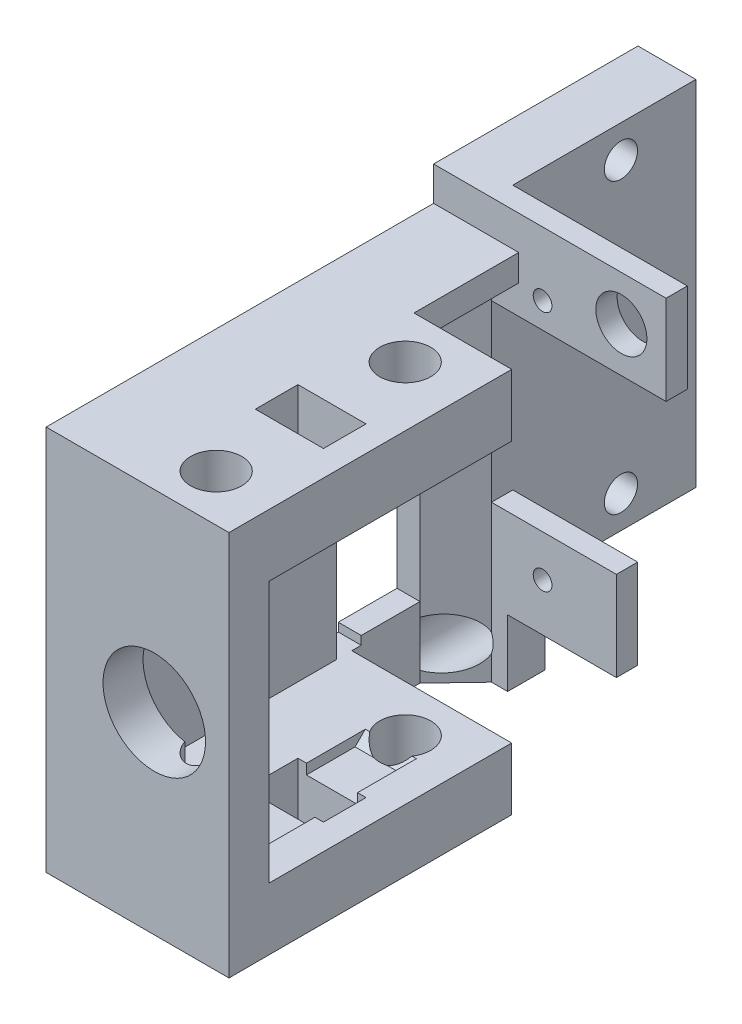
from build123d import *

# Parameters (mm, degrees)
CROQUIS4_W              = 45.5
CROQUIS4_H              = 45.3
SALIENTE_EXTRUIR3_DEPTH = 21.47
CROQUIS5_W              = 41.141731218
CROQUIS5_H              = 30.7
CORTAR_EXTRUIR2_DEPTH   = 18.77
CROQUIS6_W              = 18.6
CROQUIS6_H              = 24.6
CORTAR_EXTRUIR3_DEPTH   = 18.77
CROQUIS7_R              = 3
CORTAR_EXTRUIR4_DEPTH   = 58.77
CROQUIS8_R              = 6.02
CORTAR_EXTRUIR5_DEPTH   = 58.77
CROQUIS9_W              = 6
CROQUIS9_H              = 16.319841708
CORTAR_EXTRUIR7_DEPTH   = 1.2
CHAFL_N1_SIZE           = 1.2
CROQUIS10_W             = 8
CROQUIS10_H             = 5
CORTAR_EXTRUIR8_DEPTH   = 71.2
CROQUIS11_W             = 6
CROQUIS11_H             = 16.418152186
CORTAR_EXTRUIR9_DEPTH   = 1.2
CHAFL_N2_SIZE           = 1.2
CORTAR_EXTRUIR12_DEPTH  = 11.2
CORTAR_EXTRUIR14_DEPTH  = 7
CROQUIS15_W             = 12.3
CROQUIS15_H             = 4.2
CORTAR_EXTRUIR15_DEPTH  = 9.47
CROQUIS16_W             = 7
CROQUIS16_H             = 5
CORTAR_EXTRUIR17_DEPTH  = 0.3
CROQUIS17_W             = 7
CROQUIS17_H             = 0.8
SALIENTE_EXTRUIR4_DEPTH = 3
CROQUIS18_W             = 21.819351721
CROQUIS18_H             = 12.3
CORTAR_EXTRUIR18_DEPTH  = 53
SALIENTE_EXTRUIR5_START = -2.7
CROQUIS19_W             = 24
CROQUIS19_H             = 41.5
SALIENTE_EXTRUIR5_DEPTH = 6.8
CROQUIS21_W             = 2.5
CROQUIS21_H             = 10.5
SALIENTE_EXTRUIR6_DEPTH = 20.5
CROQUIS22_R             = 1.95
CORTAR_EXTRUIR19_DEPTH  = 20.5
CROQUIS23_W             = 9.795322327
CROQUIS23_H             = 20.802243728
CORTAR_EXTRUIR20_DEPTH  = 20.5
CROQUIS24_R             = 1.1
CORTAR_EXTRUIR22_DEPTH  = 2.5
CROQUIS25_W             = 2.17
CROQUIS25_H             = 12.3
CORTAR_EXTRUIR23_DEPTH  = 13
CROQUIS26_R             = 3
CORTAR_EXTRUIR24_DEPTH  = 2.5
SALIENTE_EXTRUIR7_REACH = 70.642
CROQUIS31_W             = 4.4
CROQUIS31_H             = 7.8
SALIENTE_EXTRUIR8_DEPTH = 8.7
CROQUIS32_R             = 3
CORTAR_EXTRUIR25_DEPTH  = 8.7


# Some blends are built 0.0001 mm under size
with BuildPart() as part:
    # Croquis4 → Saliente-Extruir3 (new body)
    with BuildSketch(Plane(origin=(0, 0, 0), x_dir=(0, 0, -1), z_dir=(1, 0, 0))):
        Rectangle(CROQUIS4_W, CROQUIS4_H)
    extrude(amount=SALIENTE_EXTRUIR3_DEPTH)

    # Croquis5 → Cortar-Extruir2 (cut)
    with BuildSketch(Plane(origin=(21.47, 0, 0), x_dir=(0, 0, -1), z_dir=(1, 0, 0))):
        with Locations((2.520865609, 0)):
            Rectangle(CROQUIS5_W, CROQUIS5_H)
    extrude(amount=-CORTAR_EXTRUIR2_DEPTH, mode=Mode.SUBTRACT)

    # Croquis6 → Cortar-Extruir3 (cut)
    with BuildSketch(Plane(origin=(0, 22.65, 0), x_dir=(1, 0, 0), z_dir=(0, 1, 0))):
        with Locations((21.47, 22.75)):
            Rectangle(CROQUIS6_W, CROQUIS6_H)
    extrude(amount=-CORTAR_EXTRUIR3_DEPTH, mode=Mode.SUBTRACT)

    # Croquis7 → Cortar-Extruir4 (cut)
    with BuildSketch(Plane(origin=(0, 22.65, 0), x_dir=(1, 0, 0), z_dir=(0, 1, 0))):
        with Locations(Location((14.47, -17.25, 0), (0, 0, 270))):
            Circle(CROQUIS7_R)
        with Locations(Location((14.47, 4.95, 0), (0, 0, 270))):
            Circle(CROQUIS7_R)
    extrude(amount=-CORTAR_EXTRUIR4_DEPTH, mode=Mode.SUBTRACT)

    # Croquis8 → Cortar-Extruir5 (cut)
    with BuildSketch(Plane.XY.offset(22.75)):
        with Locations((12.7, 0)):
            Circle(CROQUIS8_R)
    extrude(amount=-CORTAR_EXTRUIR5_DEPTH, mode=Mode.SUBTRACT)

    # Croquis9 → Cortar-Extruir7 (cut)
    with BuildSketch(Plane.XZ.offset(-15.35)):
        with Locations((14.47, 6.060847086)):
            Rectangle(CROQUIS9_W, CROQUIS9_H)
    extrude(amount=-CORTAR_EXTRUIR7_DEPTH, mode=Mode.SUBTRACT)

    # Chaflán1
    # the kernel refuses this chamfer: 1.2 mm, written as the material it takes off along each edge
    with BuildSketch(Plane(origin=(12.317907402, 15.35, -2.099073768), x_dir=(0, -0.027495876610584495, -0.9996219169112968), z_dir=(1, 0, 0)), Plane(origin=(11.47, 15.35, -2.099073768), x_dir=(0, -0.027495876610584533, -0.9996219169112968), z_dir=(1, 0, 0))) as chafl_n1_piece_1:
        Polygon((CHAFL_N1_SIZE * 0.999621916911, CHAFL_N1_SIZE * 0.0274958766106), (-CHAFL_N1_SIZE * 0.0274958766106, CHAFL_N1_SIZE * 0.999621916911), (0, 0), align=None)
    extrude(amount=5.152092598, mode=Mode.SUBTRACT)
    with BuildSketch(Plane(origin=(17.47, 15.35, 14.22076794), x_dir=(0, -0.027495876610585984, 0.9996219169112968), z_dir=(-1, 0, 0))) as chafl_n1_piece_2_section:
        Polygon((CHAFL_N1_SIZE * 0.999621916911, CHAFL_N1_SIZE * 0.0274958766106), (-CHAFL_N1_SIZE * 0.0274958766106, CHAFL_N1_SIZE * 0.999621916911), (0, 0), align=None)
    chafl_n1_piece_2 = extrude(amount=6, mode=Mode.PRIVATE)
    chafl_n1_piece_2 = split(chafl_n1_piece_2, bisect_by=Plane(origin=(14.47, 16.55, 14.617252925), z_dir=(0, -1, 0)), keep=Keep.TOP, mode=Mode.PRIVATE)
    add(chafl_n1_piece_2, mode=Mode.SUBTRACT)

    # Croquis10 → Cortar-Extruir8 (cut)
    with BuildSketch(Plane(origin=(0, 22.65, 0), x_dir=(1, 0, 0), z_dir=(0, 1, 0))):
        with Locations((14.47, -6.15)):
            Rectangle(CROQUIS10_W, CROQUIS10_H)
    extrude(amount=-CORTAR_EXTRUIR8_DEPTH, mode=Mode.SUBTRACT)

    # Croquis11 → Cortar-Extruir9 (cut)
    with BuildSketch(Plane(origin=(0, -15.35, 0), x_dir=(1, 0, 0), z_dir=(0, 1, 0))):
        with Locations((14.47, -6.15)):
            Rectangle(CROQUIS11_W, CROQUIS11_H)
    extrude(amount=-CORTAR_EXTRUIR9_DEPTH, mode=Mode.SUBTRACT)

    # Chaflán2
    chafl_n2_edges = [part.edges().sort_by_distance(p)[0] for p in [
        (12.569201122, -15.35, -2.059076093),
        (16.370798878, -15.35, -2.059076093),
        (12.569201122, -15.35, 14.359076093),
        (16.370798878, -15.35, 14.359076093),
    ]]
    chamfer(chafl_n2_edges, length=CHAFL_N2_SIZE - 0.0001)  # a hair under: the kernel refuses the full size

    # Croquis12 → Cortar-Extruir12 (cut)
    with BuildSketch(Plane(origin=(2.7, 0, 0), x_dir=(0, 0, -1), z_dir=(1, 0, 0))):
        Polygon((8.65, 15.35), (8.65, -15.35), (11.55469898, -15.35), (11.55469898, -14.35), (18.45, -14.35), (18.45, 15.35), align=None)
    extrude(amount=-CORTAR_EXTRUIR12_DEPTH, mode=Mode.SUBTRACT)

    # Croquis14 → Cortar-Extruir14 (cut)
    with BuildSketch(Plane(origin=(2.7, 0, 0), x_dir=(0, 0, -1), z_dir=(1, 0, 0))):
        Polygon((10.15, 15.35), (5.15, 15.35), (10.15, 20.35), align=None)
    extrude(amount=CORTAR_EXTRUIR14_DEPTH, mode=Mode.SUBTRACT)

    # Croquis15 → Cortar-Extruir15 (cut)
    with BuildSketch(Plane(origin=(12.17, 0, 0), x_dir=(0, 0, -1), z_dir=(1, 0, 0))):
        with Locations((16.6, 17.45)):
            Rectangle(CROQUIS15_W, CROQUIS15_H)
    extrude(amount=-CORTAR_EXTRUIR15_DEPTH, mode=Mode.SUBTRACT)

    # Croquis16 → Cortar-Extruir17 (cut)
    with BuildSketch(Plane.XY.offset(-10.15)):
        with Locations((6.2, 17.85)):
            Rectangle(CROQUIS16_W, CROQUIS16_H)
    extrude(amount=-CORTAR_EXTRUIR17_DEPTH, mode=Mode.SUBTRACT)

    # Croquis17 → Saliente-Extruir4 (add)
    with BuildSketch(Plane(origin=(0, 0, -10.45), x_dir=(-1, 0, 0), z_dir=(0, 0, -1))):
        with Locations((-6.2, 19.95)):
            Rectangle(CROQUIS17_W, CROQUIS17_H)
    extrude(amount=-SALIENTE_EXTRUIR4_DEPTH)

    # Croquis18 → Cortar-Extruir18 (cut)
    with BuildSketch(Plane.XZ.offset(-19.55)):
        with Locations((13.609675861, -16.6)):
            Rectangle(CROQUIS18_W, CROQUIS18_H)
    extrude(amount=CORTAR_EXTRUIR18_DEPTH, mode=Mode.SUBTRACT)

    # Croquis19 → Saliente-Extruir5 (add)
    with BuildSketch(Plane(origin=(2.7, 0, 0), x_dir=(0, 0, -1), z_dir=(1, 0, 0)).offset(SALIENTE_EXTRUIR5_START)):
        with Locations((34.75, 5.9)):
            Rectangle(CROQUIS19_W, CROQUIS19_H)
    extrude(amount=SALIENTE_EXTRUIR5_DEPTH)

    # Croquis21 → Saliente-Extruir6 (add)
    with BuildSketch(Plane(origin=(6.8, 0, 0), x_dir=(0, 0, -1), z_dir=(1, 0, 0))):
        with Locations((24, 21.4)):
            Rectangle(CROQUIS21_W, CROQUIS21_H)
        with Locations((24, -9.6)):
            Rectangle(CROQUIS21_W, CROQUIS21_H)
    extrude(amount=SALIENTE_EXTRUIR6_DEPTH)

    # Croquis22 → Cortar-Extruir19 (cut)
    with BuildSketch(Plane(origin=(6.8, 0, 0), x_dir=(0, 0, -1), z_dir=(1, 0, 0))):
        with Locations((37.95, 22.85)):
            Circle(CROQUIS22_R)
        with Locations((37.95, -11.05)):
            Circle(CROQUIS22_R)
    extrude(amount=-CORTAR_EXTRUIR19_DEPTH, mode=Mode.SUBTRACT)

    # Croquis23 → Cortar-Extruir20 (cut)
    with BuildSketch(Plane(origin=(0, 0, -10.45), x_dir=(-1, 0, 0), z_dir=(0, 0, -1))):
        with Locations((-26.367661164, -11.870604275)):
            Rectangle(CROQUIS23_W, CROQUIS23_H)
    extrude(amount=CORTAR_EXTRUIR20_DEPTH, mode=Mode.SUBTRACT)

    # Croquis24 → Cortar-Extruir22 (cut)
    with BuildSketch(Plane(origin=(0, 0, -25.25), x_dir=(-1, 0, 0), z_dir=(0, 0, -1))):
        with Locations((-12.8, -9.25)):
            Circle(CROQUIS24_R)
        with Locations((-12.8, 19.15)):
            Circle(CROQUIS24_R)
    extrude(amount=-CORTAR_EXTRUIR22_DEPTH, mode=Mode.SUBTRACT)

    # Croquis25 → Cortar-Extruir23 (cut)
    with BuildSketch(Plane.XZ.offset(-19.55)):
        with Locations((11.085, -16.6)):
            Rectangle(CROQUIS25_W, CROQUIS25_H)
    extrude(amount=-CORTAR_EXTRUIR23_DEPTH, mode=Mode.SUBTRACT)

    # Croquis26 → Cortar-Extruir24 (cut)
    with BuildSketch(Plane(origin=(0, 0, -25.25), x_dir=(-1, 0, 0), z_dir=(0, 0, -1))):
        with Locations(Location((-22.05, 21.4, 0), (0, 0, 90))):
            Circle(CROQUIS26_R)
    extrude(amount=-CORTAR_EXTRUIR24_DEPTH, mode=Mode.SUBTRACT)

    # Saliente-Extruir7: up to this face of the body (flat: up to its plane)
    saliente_extruir7_end = Plane(part.part.faces().sort_by_distance((9.699863726, -22.65, 4.986693104))[0])
    # Croquis30 → Saliente-Extruir7 (add, up to the picked face)
    with BuildSketch(Plane.XZ.offset(-19.55), mode=Mode.PRIVATE) as saliente_extruir7_sk1:
        Polygon((2.7, -18.45), (6.8, -22.75), (2.7, -22.75), align=None)
    saliente_extruir7_tool1 = split(extrude(saliente_extruir7_sk1.sketch, amount=SALIENTE_EXTRUIR7_REACH, mode=Mode.PRIVATE), bisect_by=saliente_extruir7_end, keep=Keep.BOTH, mode=Mode.PRIVATE)
    add(saliente_extruir7_tool1.solids().sort_by(Axis((4.066667, 19.55, -21.316667), (0, -1, 0)))[0])

    # Croquis31 → Saliente-Extruir8 (add)
    with BuildSketch(Plane.ZY):
        with Locations((-24.95, -18.75)):
            Rectangle(CROQUIS31_W, CROQUIS31_H)
    extrude(amount=-SALIENTE_EXTRUIR8_DEPTH)

    # Croquis32 → Cortar-Extruir25 (cut)
    with BuildSketch(Plane(origin=(0, 0, -27.15), x_dir=(-1, 0, 0), z_dir=(0, 0, -1))):
        with Locations((-4, -18.65)):
            Circle(CROQUIS32_R)
    extrude(amount=-CORTAR_EXTRUIR25_DEPTH, mode=Mode.SUBTRACT)


solid = part.part
